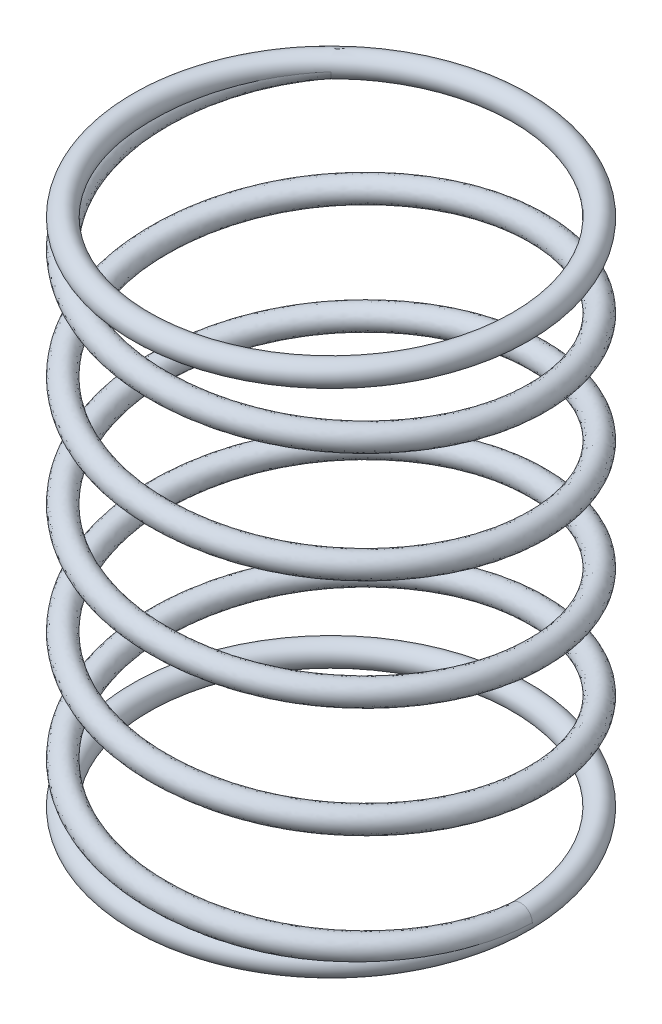
from build123d import *
from build123d.topology import SkipClean

# Parameters (mm, degrees)
SWEEP1_PITCH = 1.5999999999999976
SKETCH1_2_R  = 0.16779815294473835
SKETCH3_R    = 0.16779815294473868


with BuildPart() as part:
    # Sweep1: arcs per turn and ends read off the stored shape
    # Sweep1: the profile of Sketch1 screwed along a left-hand helix through 4.625 turns, 8 arcs to a turn; built about Z, then put on its axis
    sweep1_z = Axis((0, 0, 0), (0, 0, 1))
    sweep1_corners = [(-2.06319486, -2.06319486, 0), (-1.944543648, -1.944543648, 0.167798153), (-1.825892436, -1.825892436, 0), (-1.944543648, -1.944543648, -0.167798153)]
    with BuildLine(mode=Mode.PRIVATE) as sweep1_profile:
        ThreePointArc((-2.06319486, -2.06319486, 0), (-2.028442725, -2.028442725, 0.118651212), (-1.944543648, -1.944543648, 0.167798153))
        ThreePointArc((-1.944543648, -1.944543648, 0.167798153), (-1.860644572, -1.860644572, 0.118651212), (-1.825892436, -1.825892436, 0))
        ThreePointArc((-1.825892436, -1.825892436, 0), (-1.860644572, -1.860644572, -0.118651212), (-1.944543648, -1.944543648, -0.167798153))
        ThreePointArc((-1.944543648, -1.944543648, -0.167798153), (-2.028442725, -2.028442725, -0.118651212), (-2.06319486, -2.06319486, 0))
    sweep1_cap = Face(sweep1_profile.wire())
    sweep1_arcs = [((-2.06319486, -2.06319486, 0), (-2.06319486, -2.06319486, 0.167798153), (-1.944543648, -1.944543648, 0.167798153), (1, 0.7071067811865476, 1)), ((-1.944543648, -1.944543648, 0.167798153), (-1.825892436, -1.825892436, 0.167798153), (-1.825892436, -1.825892436, 0), (1, 0.7071067811865476, 1)), ((-1.825892436, -1.825892436, 0), (-1.825892436, -1.825892436, -0.167798153), (-1.944543648, -1.944543648, -0.167798153), (1, 0.7071067811865476, 1)), ((-1.944543648, -1.944543648, -0.167798153), (-2.06319486, -2.06319486, -0.167798153), (-2.06319486, -2.06319486, 0), (1, 0.7071067811865476, 1))]  # start, shoulder, end, weights
    sweep1_turn_angles = [0, -22.5, -45, -67.5, -90, -112.5, -135, -157.5, -180, -202.5, -225, -247.5, -270, -292.5, -315, -337.5, -360]
    sweep1_turn_weights = [1, 0.9238795325112867, 1, 0.9238795325112867, 1, 0.9238795325112867, 1, 0.9238795325112867, 1, 0.9238795325112867, 1, 0.9238795325112867, 1, 0.9238795325112867, 1, 0.9238795325112867, 1]
    sweep1_turn_sides = [Face.make_bezier_surface([[Vector(p[j][0], p[j][1], 0).rotate(sweep1_z, sweep1_turn_angles[2 * i + k]) / sweep1_turn_weights[2 * i + k] + Vector(0, 0, p[j][2] + -SWEEP1_PITCH * sweep1_turn_angles[2 * i + k] / 360) for k in range(3)] for j in range(3)], [[p[3][j] * sweep1_turn_weights[2 * i + k] for k in range(3)] for j in range(3)]) for p in sweep1_arcs for i in range(8)]
    sweep1_last_angles = [-1440, -1462.5, -1485, -1507.5, -1530, -1552.5, -1575, -1597.5, -1620, -1642.5, -1665]
    sweep1_last_weights = [1, 0.9238795325112867, 1, 0.9238795325112867, 1, 0.9238795325112867, 1, 0.9238795325112867, 1, 0.9238795325112867, 1]
    sweep1_last_sides = [Face.make_bezier_surface([[Vector(p[j][0], p[j][1], 0).rotate(sweep1_z, sweep1_last_angles[2 * i + k]) / sweep1_last_weights[2 * i + k] + Vector(0, 0, p[j][2] + -SWEEP1_PITCH * sweep1_last_angles[2 * i + k] / 360) for k in range(3)] for j in range(3)], [[p[3][j] * sweep1_last_weights[2 * i + k] for k in range(3)] for j in range(3)]) for p in sweep1_arcs for i in range(5)]
    sweep1 = Plane(origin=(0, 0, 0), x_dir=(-0.7071067811865537, 0, -0.7071067811865414), z_dir=(0, 1, 0)) * Solid(Shell([*[p.moved(Location((0, 0, SWEEP1_PITCH * i))) for i in range(4) for p in sweep1_turn_sides], *sweep1_last_sides, sweep1_cap, sweep1_cap.rotate(sweep1_z, -1665).moved(Location((0, 0, -SWEEP1_PITCH * -1665 / 360)))]))
    add(sweep1)

    # Sketch1<2> → Revolve1 (revolve)
    with SkipClean():  # the faces are left unmerged after this step: merging them gives an invalid solid
        with BuildSketch(Plane.XY, mode=Mode.PRIVATE) as revolve1_sk:
            with Locations((2.75, 0)):
                Circle(SKETCH1_2_R)
        revolve(revolve1_sk.sketch.rotate(Axis((0, 0, 0), (0, 1, 0)), 187.455745725), axis=Axis((0, 0, 0), (0, 1, 0)))

    # Sketch3 → Revolve2 (revolve)
    with SkipClean():  # the faces are left unmerged after this step: merging them gives an invalid solid
        with BuildSketch(Plane(origin=(0, 0, 0), x_dir=(-0.70710679613019, 0, -0.7071067662429048), z_dir=(0.7071067662429048, 0, -0.70710679613019)), mode=Mode.PRIVATE) as revolve2_sk:
            with Locations((2.75, 7.399999994618399)):
                Circle(SKETCH3_R)
        revolve(revolve2_sk.sketch.rotate(Axis((0, 0, 0), (0, 1, 0)), 232.455744514), axis=Axis((0, 0, 0), (0, 1, 0)))


solid = part.part
